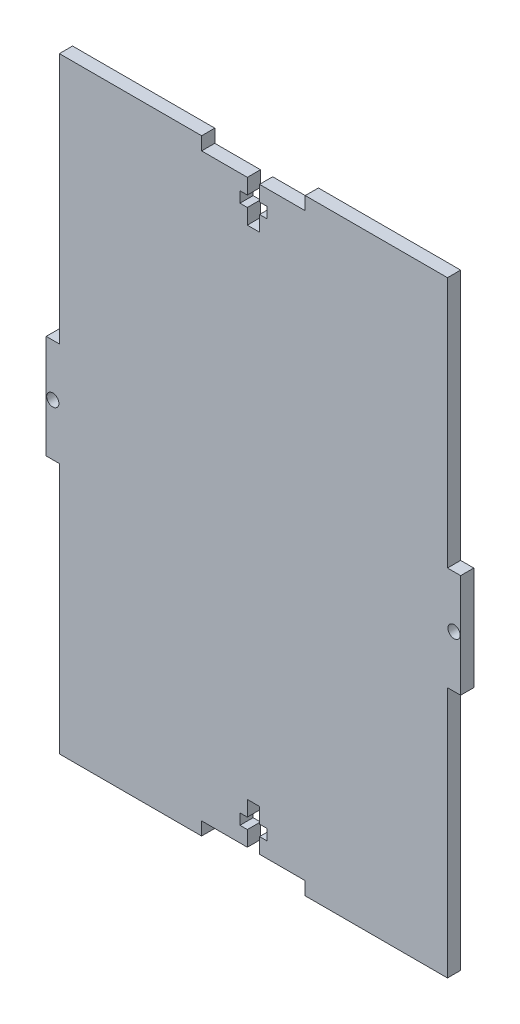
from build123d import *

# Parameters (mm, degrees)
SKETCH1_R           = 1.47
BOSS_EXTRUDE1_DEPTH = 1.5875


with BuildPart() as part:
    # Sketch1 → Boss-Extrude1 (new, symmetric)
    with BuildSketch(Plane.XY):
        Polygon((-12.5, 73.175), (-46.825, 73.175), (-46.825, 12.5), (-50, 12.5), (-50, -12.5), (-46.825, -12.5), (-46.825, -73.175), (-12.5, -73.175), (-12.5, -70), (-1.47, -70), (-1.47, -66.3), (-3.25, -66.3), (-3.25, -63.7), (-1.47, -63.7), (-1.47, -60), (1.47, -60), (1.47, -63.7), (3.25, -63.7), (3.25, -66.3), (1.47, -66.3), (1.47, -70), (12.5, -70), (12.5, -73.175), (46.825, -73.175), (46.825, -12.5), (50, -12.5), (50, 12.5), (46.825, 12.5), (46.825, 73.175), (12.5, 73.175), (12.5, 70), (1.47, 70), (1.47, 66.3), (3.25, 66.3), (3.25, 63.7), (1.47, 63.7), (1.47, 60), (-1.47, 60), (-1.47, 63.7), (-3.25, 63.7), (-3.25, 66.3), (-1.47, 66.3), (-1.47, 70), (-12.5, 70), align=None)
        with Locations((48.4125, 0)):
            Circle(SKETCH1_R, mode=Mode.SUBTRACT)
        with Locations((-48.4125, 0)):
            Circle(SKETCH1_R, mode=Mode.SUBTRACT)
    extrude(amount=BOSS_EXTRUDE1_DEPTH, both=True)


solid = part.part
